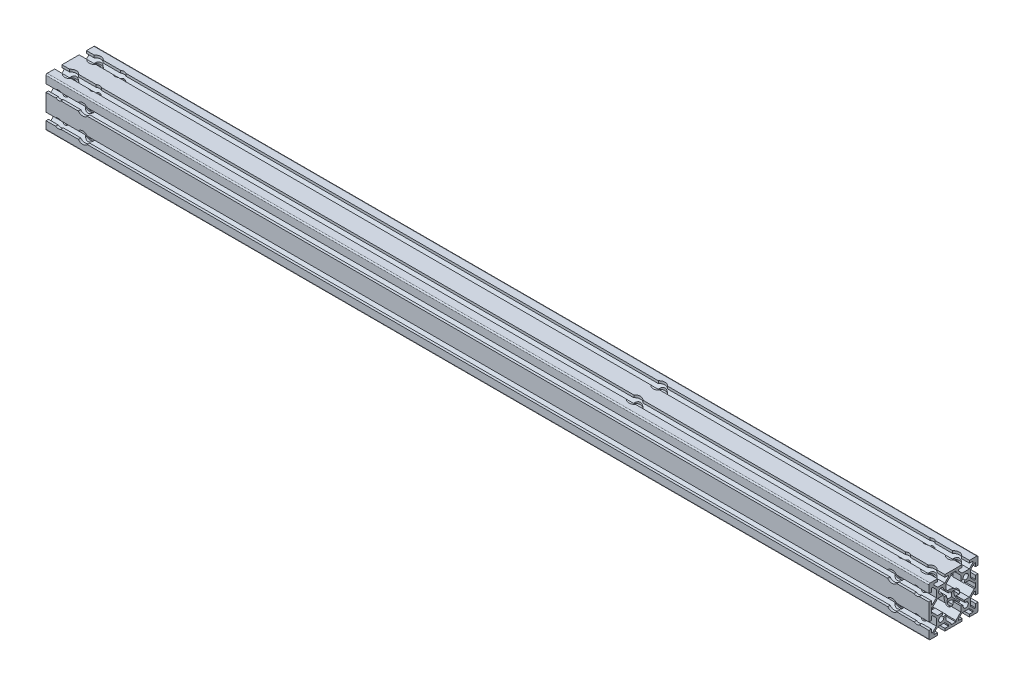
from build123d import *

# Parameters (mm, degrees)
BOSS_EXTRUDE1_DEPTH = 720
SKETCH44_R          = 3.675
CUT_EXTRUDE17_DEPTH = 40
SKETCH45_R          = 3.675
CUT_EXTRUDE18_DEPTH = 40
SKETCH56_R          = 3.675
CUT_EXTRUDE29_DEPTH = 40
SKETCH57_R          = 3.675
CUT_EXTRUDE30_DEPTH = 40
LPATTERN1_COUNT     = 2
LPATTERN1_PITCH     = 20
LPATTERN2_COUNT     = 2
LPATTERN2_PITCH     = 20
LPATTERN3_COUNT     = 2
LPATTERN3_PITCH     = 20
LPATTERN6_COUNT     = 2
LPATTERN6_PITCH     = 20
LPATTERN7_COUNT     = 2
LPATTERN7_PITCH     = 20


with BuildPart() as part:
    # Sketch1 → Boss-Extrude1 (new body)
    with BuildSketch(Plane(origin=(0, 0, 0), x_dir=(0, 0, -1), z_dir=(1, 0, 0))):
        with BuildLine():
            Line((-20, 19), (-20, 13))
            Line((-20, 13), (-18, 13))
            Line((-18, 13), (-18, 16))
            Line((-18, 16), (-17.060660172, 16))
            Line((-17.060660172, 16), (-14, 12.939339828))
            Line((-14, 12.939339828), (-14, 7.060660172))
            Line((-14, 7.060660172), (-17.060660172, 4))
            Line((-17.060660172, 4), (-18, 4))
            Line((-18, 4), (-18, 7))
            Line((-18, 7), (-20, 7))
            Line((-20, 7), (-20, -7))
            Line((-20, -7), (-18, -7))
            Line((-18, -7), (-18, -4))
            Line((-18, -4), (-17.060660172, -4))
            Line((-17.060660172, -4), (-14, -7.060660172))
            Line((-14, -7.060660172), (-14, -12.939339828))
            Line((-14, -12.939339828), (-17.060660172, -16))
            Line((-17.060660172, -16), (-18, -16))
            Line((-18, -16), (-18, -13))
            Line((-18, -13), (-20, -13))
            Line((-20, -13), (-20, -19))
            ThreePointArc((-20, -19), (-19.707106781, -19.707106781), (-19, -20))
            Line((-19, -20), (-13, -20))
            Line((-13, -20), (-13, -18))
            Line((-13, -18), (-16, -18))
            Line((-16, -18), (-16, -17.060660172))
            Line((-16, -17.060660172), (-12.939339828, -14))
            Line((-12.939339828, -14), (-7.060660172, -14))
            Line((-7.060660172, -14), (-4, -17.060660172))
            Line((-4, -17.060660172), (-4, -18))
            Line((-4, -18), (-7, -18))
            Line((-7, -18), (-7, -20))
            Line((-7, -20), (7, -20))
            Line((7, -20), (7, -18))
            Line((7, -18), (4, -18))
            Line((4, -18), (4, -17.060660172))
            Line((4, -17.060660172), (7.060660172, -14))
            Line((7.060660172, -14), (12.939339828, -14))
            Line((12.939339828, -14), (16, -17.060660172))
            Line((16, -17.060660172), (16, -18))
            Line((16, -18), (13, -18))
            Line((13, -18), (13, -20))
            Line((13, -20), (19, -20))
            ThreePointArc((19, -20), (19.707106781, -19.707106781), (20, -19))
            Line((20, -19), (20, -13))
            Line((20, -13), (18, -13))
            Line((18, -13), (18, -16))
            Line((18, -16), (17.060660172, -16))
            Line((17.060660172, -16), (14, -12.939339828))
            Line((14, -12.939339828), (14, -7.060660172))
            Line((14, -7.060660172), (17.060660172, -4))
            Line((17.060660172, -4), (18, -4))
            Line((18, -4), (18, -7))
            Line((18, -7), (20, -7))
            Line((20, -7), (20, 7))
            Line((20, 7), (18, 7))
            Line((18, 7), (18, 4))
            Line((18, 4), (17.060660172, 4))
            Line((17.060660172, 4), (14, 7.060660172))
            Line((14, 7.060660172), (14, 12.939339828))
            Line((14, 12.939339828), (17.060660172, 16))
            Line((17.060660172, 16), (18, 16))
            Line((18, 16), (18, 13))
            Line((18, 13), (20, 13))
            Line((20, 13), (20, 19))
            ThreePointArc((20, 19), (19.707106781, 19.707106781), (19, 20))
            Line((19, 20), (13, 20))
            Line((13, 20), (13, 18))
            Line((13, 18), (16, 18))
            Line((16, 18), (16, 17.060660172))
            Line((16, 17.060660172), (12.939339828, 14))
            Line((12.939339828, 14), (7.060660172, 14))
            Line((7.060660172, 14), (4, 17.060660172))
            Line((4, 17.060660172), (4, 18))
            Line((4, 18), (7, 18))
            Line((7, 18), (7, 20))
            Line((7, 20), (-7, 20))
            Line((-7, 20), (-7, 18))
            Line((-7, 18), (-4, 18))
            Line((-4, 18), (-4, 17.060660172))
            Line((-4, 17.060660172), (-7.060660172, 14))
            Line((-7.060660172, 14), (-12.939339828, 14))
            Line((-12.939339828, 14), (-16, 17.060660172))
            Line((-16, 17.060660172), (-16, 18))
            Line((-16, 18), (-13, 18))
            Line((-13, 18), (-13, 20))
            Line((-13, 20), (-19, 20))
            ThreePointArc((-19, 20), (-19.707106781, 19.707106781), (-20, 19))
        make_face()
        with BuildLine():
            Line((-16.939339828, 2), (-18, 2))
            Line((-18, 2), (-18, -2))
            Line((-18, -2), (-16.939339828, -2))
            Line((-16.939339828, -2), (-12.939339828, -6))
            Line((-12.939339828, -6), (-8.666662697, -6))
            Line((-8.666662697, -6), (-9.335919912, -8.007765667))
            ThreePointArc((-9.335919912, -8.007765667), (-11.48492424, -11.48492424), (-8.007765667, -9.335919912))
            Line((-8.007765667, -9.335919912), (-6, -8.666662697))
            Line((-6, -8.666662697), (-6, -12.939339828))
            Line((-6, -12.939339828), (-2, -16.939339828))
            Line((-2, -16.939339828), (-2, -18))
            Line((-2, -18), (2, -18))
            Line((2, -18), (2, -16.939339828))
            Line((2, -16.939339828), (6, -12.939339828))
            Line((6, -12.939339828), (6, -8.666662697))
            Line((6, -8.666662697), (8.007765667, -9.335919912))
            ThreePointArc((8.007765667, -9.335919912), (11.48492424, -11.48492424), (9.335919912, -8.007765667))
            Line((9.335919912, -8.007765667), (8.666662697, -6))
            Line((8.666662697, -6), (12.939339828, -6))
            Line((12.939339828, -6), (16.939339828, -2))
            Line((16.939339828, -2), (18, -2))
            Line((18, -2), (18, 2))
            Line((18, 2), (16.939339828, 2))
            Line((16.939339828, 2), (12.939339828, 6))
            Line((12.939339828, 6), (8.666662697, 6))
            Line((8.666662697, 6), (9.335919912, 8.007765667))
            ThreePointArc((9.335919912, 8.007765667), (11.48492424, 11.48492424), (8.007765667, 9.335919912))
            Line((8.007765667, 9.335919912), (6, 8.666662697))
            Line((6, 8.666662697), (6, 12.939339828))
            Line((6, 12.939339828), (2, 16.939339828))
            Line((2, 16.939339828), (2, 18))
            Line((2, 18), (-2, 18))
            Line((-2, 18), (-2, 16.939339828))
            Line((-2, 16.939339828), (-6, 12.939339828))
            Line((-6, 12.939339828), (-6, 8.666662697))
            Line((-6, 8.666662697), (-8.007765667, 9.335919912))
            ThreePointArc((-8.007765667, 9.335919912), (-11.48492424, 11.48492424), (-9.335919912, 8.007765667))
            Line((-9.335919912, 8.007765667), (-8.666662697, 6))
            Line((-8.666662697, 6), (-12.939339828, 6))
            Line((-12.939339828, 6), (-16.939339828, 2))
        make_face(mode=Mode.SUBTRACT)
    extrude(amount=BOSS_EXTRUDE1_DEPTH)

    # Sketch44 → Cut-Extrude17 (cut)
    with BuildSketch(Plane.XY.offset(20)):
        with Locations(Location((10, 10, 0), (0, 0, 53.112951556))):
            Circle(SKETCH44_R)
        with Locations(Location((30, 10, 0), (0, 0, 53.112951556))):
            Circle(SKETCH44_R)
        with Locations(Location((10, -10, 0), (0, 0, 306.887048444))):
            Circle(SKETCH44_R)
        with Locations(Location((30, -10, 0), (0, 0, 306.887048444))):
            Circle(SKETCH44_R)
    extrude(amount=-CUT_EXTRUDE17_DEPTH, mode=Mode.SUBTRACT)

    # Sketch45 → Cut-Extrude18 (cut)
    with BuildSketch(Plane(origin=(0, 20, 0), x_dir=(1, 0, 0), z_dir=(0, 1, 0))):
        with Locations(Location((10, -10, 0), (0, 0, 306.887048444))):
            Circle(SKETCH45_R)
        with Locations(Location((30, -10, 0), (0, 0, 306.887048444))):
            Circle(SKETCH45_R)
        with Locations(Location((10, 10, 0), (0, 0, 306.887048444))):
            Circle(SKETCH45_R)
        with Locations(Location((30, 10, 0), (0, 0, 306.887048444))):
            Circle(SKETCH45_R)
    extrude(amount=-CUT_EXTRUDE18_DEPTH, mode=Mode.SUBTRACT)

    # Sketch56 → Cut-Extrude29 (cut)
    with BuildSketch(Plane.XY.offset(20)):
        with Locations(Location((710, -10, 0), (0, 0, 306.887048444))):
            Circle(SKETCH56_R)
        with Locations(Location((690, -10, 0), (0, 0, 306.887048444))):
            Circle(SKETCH56_R)
        with Locations(Location((690, 10, 0), (0, 0, 53.112951556))):
            Circle(SKETCH56_R)
        with Locations(Location((710, 10, 0), (0, 0, 53.112951556))):
            Circle(SKETCH56_R)
    extrude(amount=-CUT_EXTRUDE29_DEPTH, mode=Mode.SUBTRACT)

    # Sketch57 → Cut-Extrude30 (cut)
    with BuildSketch(Plane(origin=(0, 20, 0), x_dir=(1, 0, 0), z_dir=(0, 1, 0))):
        with Locations(Location((710, -10, 0), (0, 0, 233.112951556))):
            Circle(SKETCH57_R)
        with Locations(Location((690, -10, 0), (0, 0, 233.112951556))):
            Circle(SKETCH57_R)
        with Locations(Location((690, 10, 0), (0, 0, 233.112951556))):
            Circle(SKETCH57_R)
        with Locations(Location((710, 10, 0), (0, 0, 233.112951556))):
            Circle(SKETCH57_R)
    extrude(amount=-CUT_EXTRUDE30_DEPTH, mode=Mode.SUBTRACT)

    # Sketch80 → Cut-Revolve1 (revolve, cut)
    with BuildSketch(Plane(origin=(10, 0, 0), x_dir=(0, 0, -1), z_dir=(1, 0, 0)), mode=Mode.PRIVATE) as cut_revolve1_sk:
        Polygon((10, -20), (12.75, -20), (12.75, 14), (14.75, 14), (14.75, 20), (10, 20), align=None)
    cut_revolve1 = revolve(cut_revolve1_sk.sketch.rotate(Axis((10, 20, -10), (0, -1, 0)), 246.167689909), axis=Axis((10, 20, -10), (0, -1, 0)), mode=Mode.SUBTRACT)

    # LPattern1: Cut-Revolve1 ×2
    with Locations(*[(0, 0, i * LPATTERN1_PITCH) for i in range(1, LPATTERN1_COUNT)]):
        add(cut_revolve1, mode=Mode.SUBTRACT)

    # Sketch81 → Cut-Revolve2 (revolve, cut)
    with BuildSketch(Plane(origin=(470, 0, 0), x_dir=(0, 0, -1), z_dir=(1, 0, 0)), mode=Mode.PRIVATE) as cut_revolve2_sk:
        Polygon((10, -20), (12.75, -20), (12.75, 14), (14.75, 14), (14.75, 20), (10, 20), align=None)
    cut_revolve2 = revolve(cut_revolve2_sk.sketch.rotate(Axis((470, 20, -10), (0, -1, 0)), 180), axis=Axis((470, 20, -10), (0, -1, 0)), mode=Mode.SUBTRACT)

    # LPattern2: Cut-Revolve2 ×2
    with Locations(*[(0, 0, i * LPATTERN2_PITCH) for i in range(1, LPATTERN2_COUNT)]):
        add(cut_revolve2, mode=Mode.SUBTRACT)

    # Sketch82 → Cut-Revolve3 (revolve, cut)
    with BuildSketch(Plane(origin=(710, 0, 0), x_dir=(0, 0, -1), z_dir=(1, 0, 0)), mode=Mode.PRIVATE) as cut_revolve3_sk:
        Polygon((10, -20), (12.75, -20), (12.75, 14), (14.75, 14), (14.75, 20), (10, 20), align=None)
    cut_revolve3 = revolve(cut_revolve3_sk.sketch.rotate(Axis((710, 20, -10), (0, -1, 0)), 246.167689909), axis=Axis((710, 20, -10), (0, -1, 0)), mode=Mode.SUBTRACT)

    # LPattern3: Cut-Revolve3 ×2
    with Locations(*[(0, 0, i * LPATTERN3_PITCH) for i in range(1, LPATTERN3_COUNT)]):
        add(cut_revolve3, mode=Mode.SUBTRACT)

    # Sketch85 → Cut-Revolve6 (revolve, cut)
    with BuildSketch(Plane(origin=(30, 0, 0), x_dir=(0, 0, -1), z_dir=(1, 0, 0)), mode=Mode.PRIVATE) as cut_revolve6_sk:
        Polygon((-14, -5.25), (-20, -5.25), (-20, -10), (20, -10), (20, -7.25), (-14, -7.25), align=None)
    cut_revolve6 = revolve(cut_revolve6_sk.sketch.rotate(Axis((30, -10, 20), (0, 0, -1)), 113.832299062), axis=Axis((30, -10, 20), (0, 0, -1)), mode=Mode.SUBTRACT)

    # LPattern6: Cut-Revolve6 ×2
    with Locations(*[(0, i * LPATTERN6_PITCH, 0) for i in range(1, LPATTERN6_COUNT)]):
        add(cut_revolve6, mode=Mode.SUBTRACT)

    # Sketch86 → Cut-Revolve7 (revolve, cut)
    with BuildSketch(Plane(origin=(690, 0, 0), x_dir=(0, 0, -1), z_dir=(1, 0, 0)), mode=Mode.PRIVATE) as cut_revolve7_sk:
        Polygon((-14, -5.25), (-20, -5.25), (-20, -10), (20, -10), (20, -7.25), (-14, -7.25), align=None)
    cut_revolve7 = revolve(cut_revolve7_sk.sketch.rotate(Axis((690, -10, 20), (0, 0, -1)), 113.832299062), axis=Axis((690, -10, 20), (0, 0, -1)), mode=Mode.SUBTRACT)

    # LPattern7: Cut-Revolve7 ×2
    with Locations(*[(0, i * LPATTERN7_PITCH, 0) for i in range(1, LPATTERN7_COUNT)]):
        add(cut_revolve7, mode=Mode.SUBTRACT)


solid = part.part
